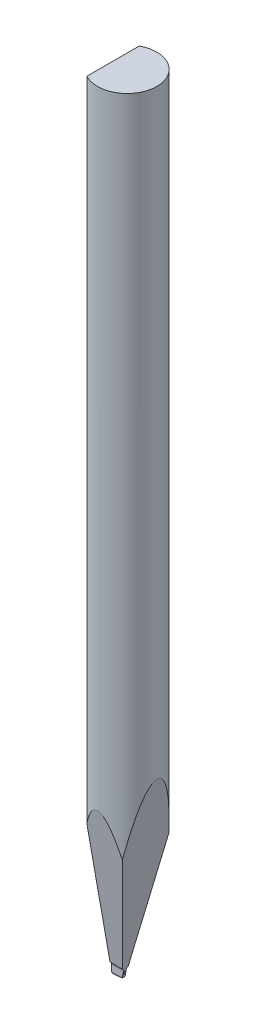
from build123d import *

# Parameters (mm, degrees)
TD_SKETCH_R                             = 0.79248
TL_FEATURE_DEPTH                        = 21.0312
TDF_STD_SKETCH_W                        = 2.09296
TDF_STD_SKETCH_H                        = 2.09296
TDF_STD_FEATURE_DEPTH                   = 22.061040395
ISA_20_STD_FEATURE_DEPTH                = 22.061040395
ISA_20_STD_FEATURE_DEPTH_BACK           = 22.061040395
VW_STD_FEATURE_DEPTH                    = 22.061040395
VW_STD_FEATURE_DEPTH_BACK               = 22.061040395
F_10BA_STD_FEATURE_DEPTH                = 22.061040503
F_10BA_STD_FEATURE_DEPTH_BACK           = 22.061040503
FRO_STD_FEATURE_DEPTH                   = 22.061040395
FRO_STD_FEATURE_DEPTH_BACK              = 22.061040395
C_STD_FEATURE_DEPTH                     = 22.061040395
C_STD_FEATURE_DEPTH_BACK                = 22.061040395
ERW_STD_FEATURE_DEPTH                   = 0.018159984
H_STD_FEATURE_REACH                     = 22.957
H_STD_SKETCH_R                          = 0.01778
H_STD_SKETCH_3_R                        = 0.01778
FUNNEL_FINAL_DIAMETRE_STD_FEATURE_DEPTH = 2.499995
FUNNEL_FINAL_DIAMETRE_STD_FEATURE_DRAFT = -22.5
ROUND_BR_STD_FEATURE_START              = -1
ROUND_BR_STD_FEATURE_DEPTH              = 0.936596355


with BuildPart() as part:
    # TD_sketch → TL_feature (new body)
    with BuildSketch(Plane(origin=(0, 0, 0), x_dir=(1, 0, 0), z_dir=(0, 1, 0))):
        with Locations(Location((0, 0, 0), (0, 0, 270))):
            Circle(TD_SKETCH_R)
    extrude(amount=TL_FEATURE_DEPTH)

    # TDF_STD_sketch → TDF_STD_feature (cut, through all)
    with BuildSketch(Plane(origin=(0, 0, 0), x_dir=(1, 0, 0), z_dir=(0, 1, 0))):
        with Locations((-1.4224, 0)):
            Rectangle(TDF_STD_SKETCH_W, TDF_STD_SKETCH_H)
    extrude(amount=TDF_STD_FEATURE_DEPTH, mode=Mode.SUBTRACT)

    # ISA_20_STD_sketch → ISA_20_STD_feature (cut, two sides: drawn at the far end of the back side and taken through both)
    with BuildSketch(Plane(origin=(0, 0, 0), x_dir=(0, 0, -1), z_dir=(1, 0, 0)).offset(-ISA_20_STD_FEATURE_DEPTH_BACK)):
        Polygon((-12.948362797, 73.253751326), (-3.740117997, 21.0312), (-0.03175, 0), (0.03175, 0), (3.740117997, 21.0312), (12.948362797, 73.253751326), (12.948362797, -32.802585388), (-12.948362797, -32.802585388), align=None)
    extrude(amount=ISA_20_STD_FEATURE_DEPTH + ISA_20_STD_FEATURE_DEPTH_BACK, mode=Mode.SUBTRACT)

    # VW_STD_sketch → VW_STD_feature (cut, two sides: drawn at the far end of the back side and taken through both)
    with BuildSketch(Plane(origin=(0, 0, 0), x_dir=(0, 0, -1), z_dir=(1, 0, 0)).offset(-VW_STD_FEATURE_DEPTH_BACK)):
        with BuildLine():
            Line((-70.567982417, 70.76464549), (-20.834536927, 21.0312))
            Line((-20.834536927, 21.0312), (-0.060418463, 0.257081537))
            ThreePointArc((-0.060418463, 0.257081537), (-0.04390038, 0.232360478), (-0.0381, 0.2032))
            Line((-0.0381, 0.2032), (-0.0381, 0))
            Line((-0.0381, 0), (0.0381, 0))
            Line((0.0381, 0), (0.0381, 0.2032))
            ThreePointArc((0.0381, 0.2032), (0.04390038, 0.232360478), (0.060418463, 0.257081537))
            Line((0.060418463, 0.257081537), (20.834536927, 21.0312))
            Line((20.834536927, 21.0312), (70.567982417, 70.76464549))
            Line((70.567982417, 70.76464549), (70.567982417, -69.902780741))
            Line((70.567982417, -69.902780741), (-70.567982417, -69.902780741))
            Line((-70.567982417, -69.902780741), (-70.567982417, 70.76464549))
        make_face()
    extrude(amount=VW_STD_FEATURE_DEPTH + VW_STD_FEATURE_DEPTH_BACK, mode=Mode.SUBTRACT)

    # 10BA_STD_sketch → 10BA_STD_feature (cut, two sides: drawn at the far end of the back side and taken through both)
    with BuildSketch(Plane.XY.offset(-F_10BA_STD_FEATURE_DEPTH_BACK)):
        Polygon((-53.187772193, 0), (-0.37592, 0), (-0.2921, 0), (-0.091550146, 0.028185444), (3.611847997, 21.0312), (12.782529889, 73.04072149), (91.167207648, 2.243763782), (25.196905566, -70.796957708), align=None)
    extrude(amount=F_10BA_STD_FEATURE_DEPTH + F_10BA_STD_FEATURE_DEPTH_BACK, mode=Mode.SUBTRACT)

    # FRO_STD_sketch → FRO_STD_feature (cut, two sides: drawn at the far end of the back side and taken through both)
    with BuildSketch(Plane.XY.offset(-FRO_STD_FEATURE_DEPTH_BACK)):
        with BuildLine():
            Line((-0.37592, 52.152138388), (-0.37592, 0.02794))
            ThreePointArc((-0.37592, 0.02794), (-0.367736563, 0.008183437), (-0.34798, 0))
            Line((-0.34798, 0), (51.776218388, 0))
            Line((51.776218388, 0), (-21.9385299, -73.714748288))
            Line((-21.9385299, -73.714748288), (-74.090668288, -21.5626099))
            Line((-74.090668288, -21.5626099), (-0.37592, 52.152138388))
        make_face()
    extrude(amount=FRO_STD_FEATURE_DEPTH + FRO_STD_FEATURE_DEPTH_BACK, mode=Mode.SUBTRACT)

    # C_STD_sketch → C_STD_feature (cut, two sides: drawn at the far end of the back side and taken through both)
    with BuildSketch(Plane(origin=(0, 0, 0), x_dir=(0, 0, -1), z_dir=(1, 0, 0)).offset(-C_STD_FEATURE_DEPTH_BACK)):
        with BuildLine():
            Line((-50.530423385, -12.791040855), (-0.030559272, 0))
            ThreePointArc((-0.030559272, 0), (0, 0.00381), (0.030559272, 0))
            Line((0.030559272, 0), (50.530423385, -12.791040855))
            Line((50.530423385, -12.791040855), (50.530423385, -116.980234183))
            Line((50.530423385, -116.980234183), (-50.530423385, -116.980234183))
            Line((-50.530423385, -116.980234183), (-50.530423385, -12.791040855))
        make_face()
    extrude(amount=C_STD_FEATURE_DEPTH + C_STD_FEATURE_DEPTH_BACK, mode=Mode.SUBTRACT)


with BuildPart() as body_2:
    # ERW_STD_sketch → ERW_STD_feature (new, symmetric)
    with BuildSketch(Plane.XY):
        Polygon((-0.18288, 0.05842), (-0.18288, 0), (-0.32766, 0), (-0.283637372, 0.05842), align=None)
    extrude(amount=ERW_STD_FEATURE_DEPTH, both=True)

    # H_STD_sketch → H_STD_feature (add, up to next)
    with BuildSketch(Plane(origin=(-0.096399563, 0.108349503, 0), x_dir=(0, 0, -1), z_dir=(0.8660254037844415, 0.4999999999999953, 0)), mode=Mode.PRIVATE) as h_std_feature_sk1:
        with Locations(Location((0, 0, 0), (0, 0, 90))):
            Circle(H_STD_SKETCH_R)
    h_std_feature_tool1 = extrude(h_std_feature_sk1.sketch, amount=-H_STD_FEATURE_REACH, mode=Mode.PRIVATE) - body_2.part
    add(h_std_feature_tool1.solids().sort_by_distance((-0.0964, 0.10835, 0))[0])


with BuildPart() as funnel_final_diametre_std_feature_tool:
    # H_STD_sketch<3> → funnel_final_diametre_STD_feature (with draft: the straight prism first)
    with BuildSketch(Plane(origin=(-0.096399563, 0.108349503, 0), x_dir=(0, 0, -1), z_dir=(0.8660254037844415, 0.4999999999999953, 0))):
        with Locations(Location((0, 0, 0), (0, 0, 90))):
            Circle(H_STD_SKETCH_3_R)
    extrude(amount=FUNNEL_FINAL_DIAMETRE_STD_FEATURE_DEPTH)
    # funnel_final_diametre_STD_feature: the draft: its side faces are tilted about the plane it starts from
    funnel_final_diametre_std_feature_sides = [funnel_final_diametre_std_feature_tool.faces().sort_by_distance(p)[0] for p in [
        (0.995020026, 0.717950322, 0),
    ]]
    draft(funnel_final_diametre_std_feature_sides, Plane(origin=(-0.096399563, 0.108349503, 0), x_dir=(0, 0, -1), z_dir=(0.8660254037844415, 0.4999999999999953, 0)), FUNNEL_FINAL_DIAMETRE_STD_FEATURE_DRAFT)


with BuildPart() as body_2_1:
    add(body_2.part)

    # funnel_final_diametre_STD_feature: add funnel_final_diametre_std_feature_tool
    add(funnel_final_diametre_std_feature_tool.part)

    # ROUND_BR_STD_feature: read off the stored shape, not the designer's step
    # ROUND_BR_STD_feature outline → ROUND_BR_STD_feature (cut)
    with BuildSketch(Plane(origin=(0, 0, 0), x_dir=(0.79863551004729, -0.601815023152052, 0), z_dir=(0.601815023152052, 0.79863551004729, 0)).offset(ROUND_BR_STD_FEATURE_START)):
        with BuildLine():
            Line((-0.261680911, -0.018159984), (-0.243520927, -0.018159984))
            ThreePointArc((-0.243520927, -0.018159984), (-0.256361975, -0.012841048), (-0.261680911, 0))
            Line((-0.261680911, 0), (-0.261680911, -0.018159984))
        make_face()
        with BuildLine():
            Line((-0.261680911, 0.018159984), (-0.261680911, 0))
            ThreePointArc((-0.261680911, 0), (-0.256361975, 0.012841048), (-0.243520927, 0.018159984))
            Line((-0.243520927, 0.018159984), (-0.261680911, 0.018159984))
        make_face()
    extrude(amount=ROUND_BR_STD_FEATURE_DEPTH, mode=Mode.SUBTRACT)


with BuildPart() as part_1:
    add(part.part)

    # COMBINE_STD_feature: cut body 2
    add(body_2_1.part, mode=Mode.SUBTRACT)


solid = part_1.part
